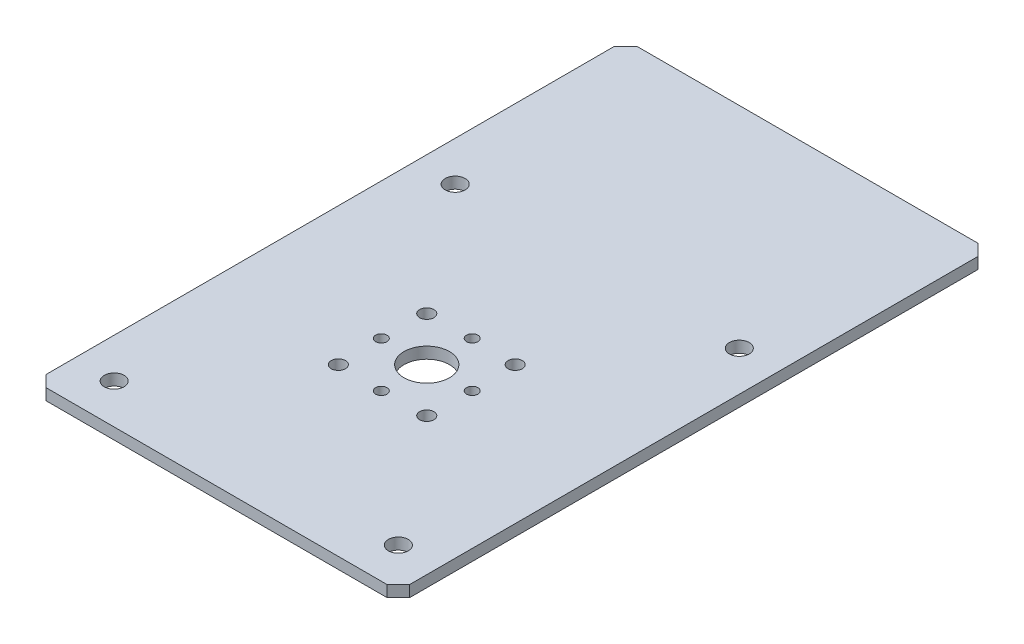
from build123d import *

# Parameters (mm, degrees)
SKETCH1_W          = 64
SKETCH1_H          = 2
BASE_FLANGE1_DEPTH = 74
SKETCH2_R          = 1.75
CUT_EXTRUDE1_DEPTH = 10
CUT_EXTRUDE2_REACH = 82.647
SKETCH4_R          = 4
CHAMFER1_SIZE      = 2
CUT_EXTRUDE5_REACH = 82.647
SKETCH7_R          = 1
SKETCH7_R_2        = 1.25
SKETCH8_W          = 64
SKETCH8_H          = 30
TAB1_DEPTH         = 2
CHAMFER2_SIZE      = 2


# Sheet-metal steps are written as plain solids
with BuildPart() as part:
    # Sketch1 → Base-Flange1 (new body)
    with BuildSketch(Plane.XY):
        with Locations((0, -1)):
            Rectangle(SKETCH1_W, SKETCH1_H)
    extrude(amount=BASE_FLANGE1_DEPTH)

    # Sketch2 → Cut-Extrude1 (cut)
    with BuildSketch(Plane(origin=(0, 0, 0), x_dir=(1, 0, 0), z_dir=(0, 1, 0))):
        with Locations(Location((-25, -7, 0), (0, 0, 270))):
            Circle(SKETCH2_R)
        with Locations(Location((-25, -67, 0), (0, 0, 270))):
            Circle(SKETCH2_R)
        with Locations(Location((25, -67, 0), (0, 0, 270))):
            Circle(SKETCH2_R)
        with Locations(Location((25, -7, 0), (0, 0, 270))):
            Circle(SKETCH2_R)
    extrude(amount=-CUT_EXTRUDE1_DEPTH, mode=Mode.SUBTRACT)

    # Sketch4 → Cut-Extrude2 (cut, up to next)
    with BuildSketch(Plane(origin=(0, 0, 0), x_dir=(1, 0, 0), z_dir=(0, 1, 0)), mode=Mode.PRIVATE) as cut_extrude2_sk1:
        with Locations(Location((0, -37, 0), (0, 0, 270))):
            Circle(SKETCH4_R)
    cut_extrude2_tool1 = extrude(cut_extrude2_sk1.sketch, amount=-CUT_EXTRUDE2_REACH, mode=Mode.PRIVATE) & part.part
    add(cut_extrude2_tool1.solids().sort_by_distance((0, 0, 37))[0], mode=Mode.SUBTRACT)

    # Chamfer1
    chamfer1_edges = [part.edges().sort_by_distance(p)[0] for p in [
        (-32, -1, 74),
        (32, -1, 74),
    ]]
    chamfer(chamfer1_edges, length=CHAMFER1_SIZE)

    # Sketch7 → Cut-Extrude5 (cut, up to next)
    with BuildSketch(Plane(origin=(0, 0, 0), x_dir=(1, 0, 0), z_dir=(0, 1, 0)), mode=Mode.PRIVATE) as cut_extrude5_sk1:
        with Locations(Location((-8, -37, 0), (0, 0, 270))):
            Circle(SKETCH7_R)
    cut_extrude5_tool1 = extrude(cut_extrude5_sk1.sketch, amount=-CUT_EXTRUDE5_REACH, mode=Mode.PRIVATE) & part.part
    # Sketch7 → Cut-Extrude5 (cut, up to next)
    with BuildSketch(Plane(origin=(0, 0, 0), x_dir=(1, 0, 0), z_dir=(0, 1, 0)), mode=Mode.PRIVATE) as cut_extrude5_sk2:
        with Locations(Location((8, -37, 0), (0, 0, 270))):
            Circle(SKETCH7_R)
    cut_extrude5_tool2 = extrude(cut_extrude5_sk2.sketch, amount=-CUT_EXTRUDE5_REACH, mode=Mode.PRIVATE) & part.part
    # Sketch7 → Cut-Extrude5 (cut, up to next)
    with BuildSketch(Plane(origin=(0, 0, 0), x_dir=(1, 0, 0), z_dir=(0, 1, 0)), mode=Mode.PRIVATE) as cut_extrude5_sk3:
        with Locations(Location((0, -45, 0), (0, 0, 270))):
            Circle(SKETCH7_R)
    cut_extrude5_tool3 = extrude(cut_extrude5_sk3.sketch, amount=-CUT_EXTRUDE5_REACH, mode=Mode.PRIVATE) & part.part
    # Sketch7 → Cut-Extrude5 (cut, up to next)
    with BuildSketch(Plane(origin=(0, 0, 0), x_dir=(1, 0, 0), z_dir=(0, 1, 0)), mode=Mode.PRIVATE) as cut_extrude5_sk4:
        with Locations(Location((0, -29, 0), (0, 0, 270))):
            Circle(SKETCH7_R)
    cut_extrude5_tool4 = extrude(cut_extrude5_sk4.sketch, amount=-CUT_EXTRUDE5_REACH, mode=Mode.PRIVATE) & part.part
    # Sketch7 → Cut-Extrude5 (cut, up to next)
    with BuildSketch(Plane(origin=(0, 0, 0), x_dir=(1, 0, 0), z_dir=(0, 1, 0)), mode=Mode.PRIVATE) as cut_extrude5_sk5:
        with Locations(Location((-7.778174593, -44.778174593, 0), (0, 0, 270))):
            Circle(SKETCH7_R_2)
    cut_extrude5_tool5 = extrude(cut_extrude5_sk5.sketch, amount=-CUT_EXTRUDE5_REACH, mode=Mode.PRIVATE) & part.part
    # Sketch7 → Cut-Extrude5 (cut, up to next)
    with BuildSketch(Plane(origin=(0, 0, 0), x_dir=(1, 0, 0), z_dir=(0, 1, 0)), mode=Mode.PRIVATE) as cut_extrude5_sk6:
        with Locations(Location((-7.778174593, -29.221825407, 0), (0, 0, 270))):
            Circle(SKETCH7_R_2)
    cut_extrude5_tool6 = extrude(cut_extrude5_sk6.sketch, amount=-CUT_EXTRUDE5_REACH, mode=Mode.PRIVATE) & part.part
    # Sketch7 → Cut-Extrude5 (cut, up to next)
    with BuildSketch(Plane(origin=(0, 0, 0), x_dir=(1, 0, 0), z_dir=(0, 1, 0)), mode=Mode.PRIVATE) as cut_extrude5_sk7:
        with Locations(Location((7.778174593, -29.221825407, 0), (0, 0, 270))):
            Circle(SKETCH7_R_2)
    cut_extrude5_tool7 = extrude(cut_extrude5_sk7.sketch, amount=-CUT_EXTRUDE5_REACH, mode=Mode.PRIVATE) & part.part
    # Sketch7 → Cut-Extrude5 (cut, up to next)
    with BuildSketch(Plane(origin=(0, 0, 0), x_dir=(1, 0, 0), z_dir=(0, 1, 0)), mode=Mode.PRIVATE) as cut_extrude5_sk8:
        with Locations(Location((7.778174593, -44.778174593, 0), (0, 0, 270))):
            Circle(SKETCH7_R_2)
    cut_extrude5_tool8 = extrude(cut_extrude5_sk8.sketch, amount=-CUT_EXTRUDE5_REACH, mode=Mode.PRIVATE) & part.part
    add(cut_extrude5_tool1.solids().sort_by_distance((-8, 0, 37))[0], mode=Mode.SUBTRACT)
    add(cut_extrude5_tool2.solids().sort_by_distance((8, 0, 37))[0], mode=Mode.SUBTRACT)
    add(cut_extrude5_tool3.solids().sort_by_distance((0, 0, 45))[0], mode=Mode.SUBTRACT)
    add(cut_extrude5_tool4.solids().sort_by_distance((0, 0, 29))[0], mode=Mode.SUBTRACT)
    add(cut_extrude5_tool5.solids().sort_by_distance((-7.778175, 0, 44.778175))[0], mode=Mode.SUBTRACT)
    add(cut_extrude5_tool6.solids().sort_by_distance((-7.778175, 0, 29.221825))[0], mode=Mode.SUBTRACT)
    add(cut_extrude5_tool7.solids().sort_by_distance((7.778175, 0, 29.221825))[0], mode=Mode.SUBTRACT)
    add(cut_extrude5_tool8.solids().sort_by_distance((7.778175, 0, 44.778175))[0], mode=Mode.SUBTRACT)

    # Sketch8 → Tab1 (add)
    with BuildSketch(Plane(origin=(0, 0, 0), x_dir=(1, 0, 0), z_dir=(0, 1, 0))):
        with Locations((0, 15)):
            Rectangle(SKETCH8_W, SKETCH8_H)
    extrude(amount=-TAB1_DEPTH)

    # Chamfer2
    chamfer2_edges = [part.edges().sort_by_distance(p)[0] for p in [
        (-32, -1, -30),
        (32, -1, -30),
    ]]
    chamfer(chamfer2_edges, length=CHAMFER2_SIZE)


solid = part.part
